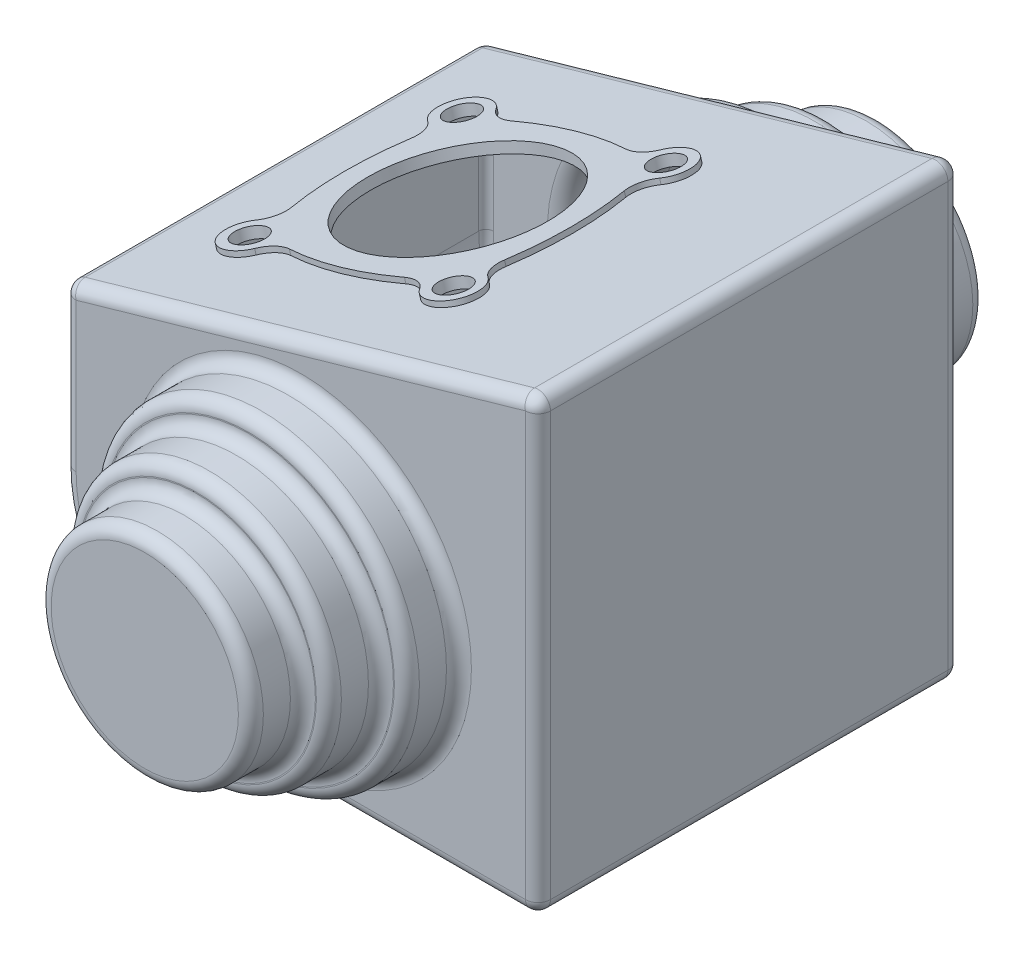
from build123d import *

# Parameters (mm, degrees)
BOSS_EXTRUDE1_DEPTH = 101.5
SKETCH4_R           = 76
BOSS_EXTRUDE3_DEPTH = 25
SKETCH4_4_R         = 63.5
BOSS_EXTRUDE4_DEPTH = 50
SKETCH4_5_R         = 51
BOSS_EXTRUDE5_DEPTH = 75
FILLET7_R           = 6
SHELL1_T            = 2.5
SKETCH5_R           = 45
SKETCH5_R_2         = 7.5
CUT_EXTRUDE1_DEPTH  = 10
BOSS_EXTRUDE6_START = 2.5
SKETCH5_4_R         = 45
SKETCH5_4_R_2       = 7.5
BOSS_EXTRUDE6_DEPTH = 2.5


with BuildPart() as part:
    # Sketch3 → Boss-Extrude1 (new, symmetric)
    with BuildSketch(Plane.XY):
        with BuildLine():
            Line((-38, -89), (114, -89))
            Line((114, -89), (114, 128.377947953))
            Line((114, 128.377947953), (-114, 63))
            Line((-114, 63), (-114, -13))
            ThreePointArc((-114, -13), (-91.74011537, -66.74011537), (-38, -89))
        make_face()
    extrude(amount=BOSS_EXTRUDE1_DEPTH, both=True)

    # Sketch4 → Boss-Extrude3 (add)
    with BuildSketch(Plane.XY.offset(101.5)):
        Circle(SKETCH4_R)
    boss_extrude3 = extrude(amount=BOSS_EXTRUDE3_DEPTH)

    # Sketch4<4> → Boss-Extrude4 (add)
    with BuildSketch(Plane.XY.offset(101.5)):
        Circle(SKETCH4_4_R)
    boss_extrude4 = extrude(amount=BOSS_EXTRUDE4_DEPTH)

    # Sketch4<5> → Boss-Extrude5 (add)
    with BuildSketch(Plane.XY.offset(101.5)):
        Circle(SKETCH4_5_R)
    boss_extrude5 = extrude(amount=BOSS_EXTRUDE5_DEPTH)

    # Mirror1: Boss-Extrude3, Boss-Extrude4, Boss-Extrude5 across plane
    add(boss_extrude3.mirror(Plane.XY))
    add(boss_extrude4.mirror(Plane.XY))
    add(boss_extrude5.mirror(Plane.XY))

    # Fillet7
    fillet7_edges = [part.edges().sort_by_distance(p)[0] for p in [
        (-51, 0, -176.5),
        (-63.5, 0, -151.5),
        (-76, 0, -101.5),
        (-76, 0, -126.5),
        (-51, 0, 176.5),
        (-51, 0, 151.5),
        (-63.5, 0, 151.5),
        (-63.5, 0, 126.5),
        (-76, 0, 126.5),
        (-91.74011537, -66.74011537, -101.5),
        (38, -89, -101.5),
        (114, 19.688973977, -101.5),
        (0, 95.688973977, -101.5),
        (-114, 25, -101.5),
        (-91.74011537, -66.74011537, 101.5),
        (38, -89, 101.5),
        (114, 19.688973977, 101.5),
        (-114, 25, 101.5),
        (-114, 63, 0),
        (114, 128.377947953, 0),
        (114, -89, 0),
        (-76, 0, 101.5),
        (-63.5, 0, -126.5),
        (-51, 0, -151.5),
        (0, 95.688973977, 101.5),
    ]]
    fillet(fillet7_edges, radius=FILLET7_R)

    # Shell1 (no face opened: a closed hollow body)
    add(offset(amount=-SHELL1_T, mode=Mode.PRIVATE), mode=Mode.SUBTRACT)

    # Sketch5 → Cut-Extrude1 (cut)
    with BuildSketch(Plane(origin=(-25.353715342, 88.41891309, 0), x_dir=(0.9612616959383197, 0.2756373558169965, 0), z_dir=(-0.27563735581699655, 0.9612616959383198, 0))):
        Circle(SKETCH5_R)
        with Locations((-51, 51)):
            Circle(SKETCH5_R_2)
        with Locations((51, 51)):
            Circle(SKETCH5_R_2)
        with Locations((51, -51)):
            Circle(SKETCH5_R_2)
        with Locations((-51, -51)):
            Circle(SKETCH5_R_2)
    extrude(amount=-CUT_EXTRUDE1_DEPTH, mode=Mode.SUBTRACT)

    # Sketch5<4> → Boss-Extrude6 (add)
    with BuildSketch(Plane(origin=(-25.353715342, 88.41891309, 0), x_dir=(0.9612616959383197, 0.2756373558169965, 0), z_dir=(-0.27563735581699655, 0.9612616959383198, 0)).offset(BOSS_EXTRUDE6_START)):
        with BuildLine():
            ThreePointArc((57.99553429, 41.25), (59.485281374, 59.485281374), (41.25, 57.99553429))
            ThreePointArc((41.25, 57.99553429), (35.726297869, 53.759933004), (28.78057554, 53.303265937))
            ThreePointArc((28.78057554, 53.303265937), (0, 56.60735464), (-28.78057554, 53.303265937))
            ThreePointArc((-28.78057554, 53.303265937), (-35.726297869, 53.759933004), (-41.25, 57.99553429))
            ThreePointArc((-41.25, 57.99553429), (-59.485281374, 59.485281374), (-57.99553429, 41.25))
            ThreePointArc((-57.99553429, 41.25), (-53.759933004, 35.726297869), (-53.303265937, 28.78057554))
            ThreePointArc((-53.303265937, 28.78057554), (-56.60735464, 0), (-53.303265937, -28.78057554))
            ThreePointArc((-53.303265937, -28.78057554), (-53.759933004, -35.726297869), (-57.99553429, -41.25))
            ThreePointArc((-57.99553429, -41.25), (-59.485281374, -59.485281374), (-41.25, -57.99553429))
            ThreePointArc((-41.25, -57.99553429), (-35.726297869, -53.759933004), (-28.78057554, -53.303265937))
            ThreePointArc((-28.78057554, -53.303265937), (0, -56.60735464), (28.78057554, -53.303265937))
            ThreePointArc((28.78057554, -53.303265937), (35.726297869, -53.759933004), (41.25, -57.99553429))
            ThreePointArc((41.25, -57.99553429), (59.485281374, -59.485281374), (57.99553429, -41.25))
            ThreePointArc((57.99553429, -41.25), (53.759933004, -35.726297869), (53.303265937, -28.78057554))
            ThreePointArc((53.303265937, -28.78057554), (56.60735464, 0), (53.303265937, 28.78057554))
            ThreePointArc((53.303265937, 28.78057554), (53.759933004, 35.726297869), (57.99553429, 41.25))
        make_face()
        Circle(SKETCH5_4_R, mode=Mode.SUBTRACT)
        with Locations((-51, 51)):
            Circle(SKETCH5_4_R_2, mode=Mode.SUBTRACT)
        with Locations((51, 51)):
            Circle(SKETCH5_4_R_2, mode=Mode.SUBTRACT)
        with Locations((51, -51)):
            Circle(SKETCH5_4_R_2, mode=Mode.SUBTRACT)
        with Locations((-51, -51)):
            Circle(SKETCH5_4_R_2, mode=Mode.SUBTRACT)
    extrude(amount=-BOSS_EXTRUDE6_DEPTH)


solid = part.part
